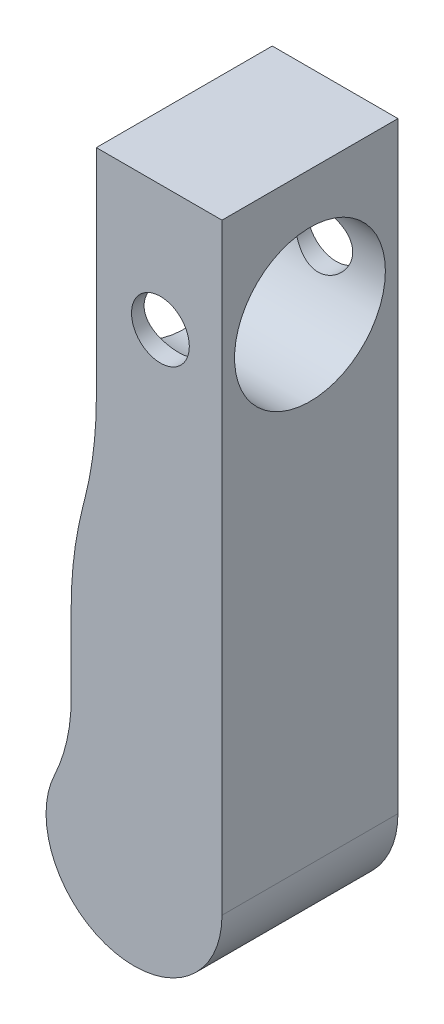
from build123d import *

# Parameters (mm, degrees)
BOSS_EXTRU_2_DEPTH         = 7
CONG_1_R                   = 7
CONG_2_R                   = 15
F_2_3_2_3_DIAMETER_HOLE1_D = 2.3
F_6_0_6_DIAMETER_HOLE1_D   = 6


with BuildPart() as part:
    # Esquisse1 → Boss.-Extru.2 (new body)
    with BuildSketch(Plane.XY):
        with BuildLine():
            Line((-5, 0), (-5, -10.5))
            Line((-5, -10.5), (-6, -14.5))
            Line((-6, -14.5), (-6, -21.5))
            ThreePointArc((-6, -21.5), (-4.822875656, -27.189860092), (0, -23.949489743))
            Line((0, -23.949489743), (0, 0))
            Line((0, 0), (-5, 0))
        make_face()
    extrude(amount=BOSS_EXTRU_2_DEPTH)

    # Congé1
    cong_1_edges = [part.edges().sort_by_distance(p)[0] for p in [
        (-6, -21.5, 3.5),
    ]]
    fillet(cong_1_edges, radius=CONG_1_R)

    # Congé2
    cong_2_edges = [part.edges().sort_by_distance(p)[0] for p in [
        (-6, -14.5, 3.5),
        (-5, -10.5, 3.5),
    ]]
    fillet(cong_2_edges, radius=CONG_2_R)

    # Ø2.3 (2.3) Diameter Hole1 (through all)
    with Locations(Plane.XY.offset(7)):
        with Locations((-2.45, -5)):
            Hole(F_2_3_2_3_DIAMETER_HOLE1_D / 2)

    # Ø6.0 (6) Diameter Hole1 (through all)
    with Locations(Plane(origin=(0, 0, 0), x_dir=(0, 0, -1), z_dir=(1, 0, 0))):
        with Locations((-3.5, -5)):
            Hole(F_6_0_6_DIAMETER_HOLE1_D / 2)


solid = part.part
